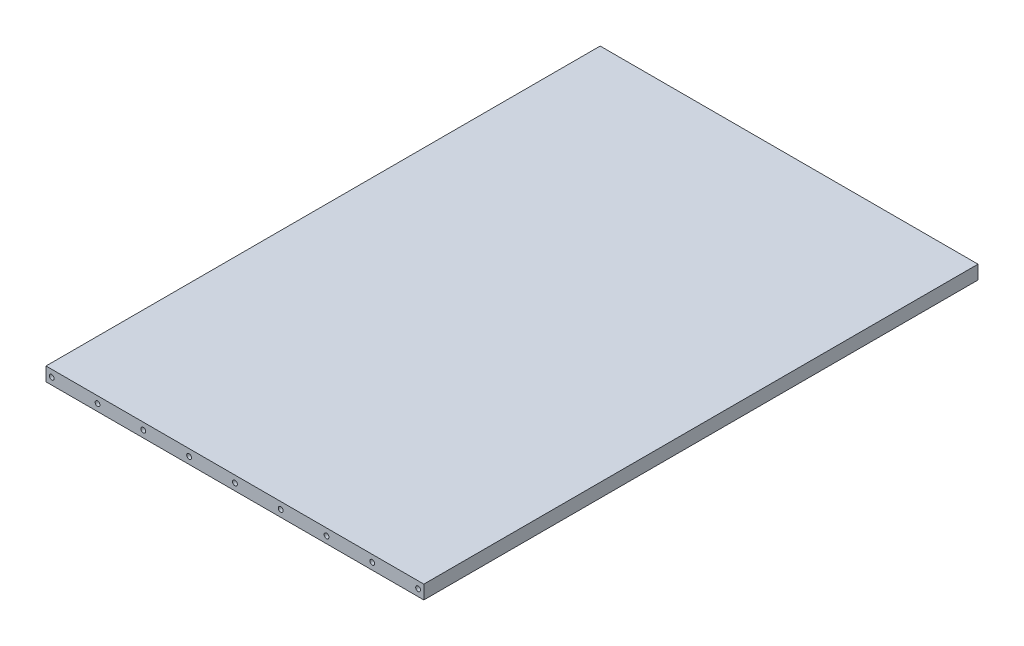
from build123d import *

# Parameters (mm, degrees)
SKETCH1_W           = 330
SKETCH1_H           = 12
SKETCH1_R           = 2.1
BOSS_EXTRUDE1_DEPTH = 484


with BuildPart() as part:
    # Sketch1 → Boss-Extrude1 (new body)
    with BuildSketch(Plane.XY):
        Rectangle(SKETCH1_W, SKETCH1_H)
        Circle(SKETCH1_R, mode=Mode.SUBTRACT)
        with Locations((40, 0)):
            Circle(SKETCH1_R, mode=Mode.SUBTRACT)
        with Locations((80, 0)):
            Circle(SKETCH1_R, mode=Mode.SUBTRACT)
        with Locations((120, 0)):
            Circle(SKETCH1_R, mode=Mode.SUBTRACT)
        with Locations((160, 0)):
            Circle(SKETCH1_R, mode=Mode.SUBTRACT)
        with Locations((-40, 0)):
            Circle(SKETCH1_R, mode=Mode.SUBTRACT)
        with Locations((-80, 0)):
            Circle(SKETCH1_R, mode=Mode.SUBTRACT)
        with Locations((-120, 0)):
            Circle(SKETCH1_R, mode=Mode.SUBTRACT)
        with Locations((-160, 0)):
            Circle(SKETCH1_R, mode=Mode.SUBTRACT)
    extrude(amount=BOSS_EXTRUDE1_DEPTH)


solid = part.part
